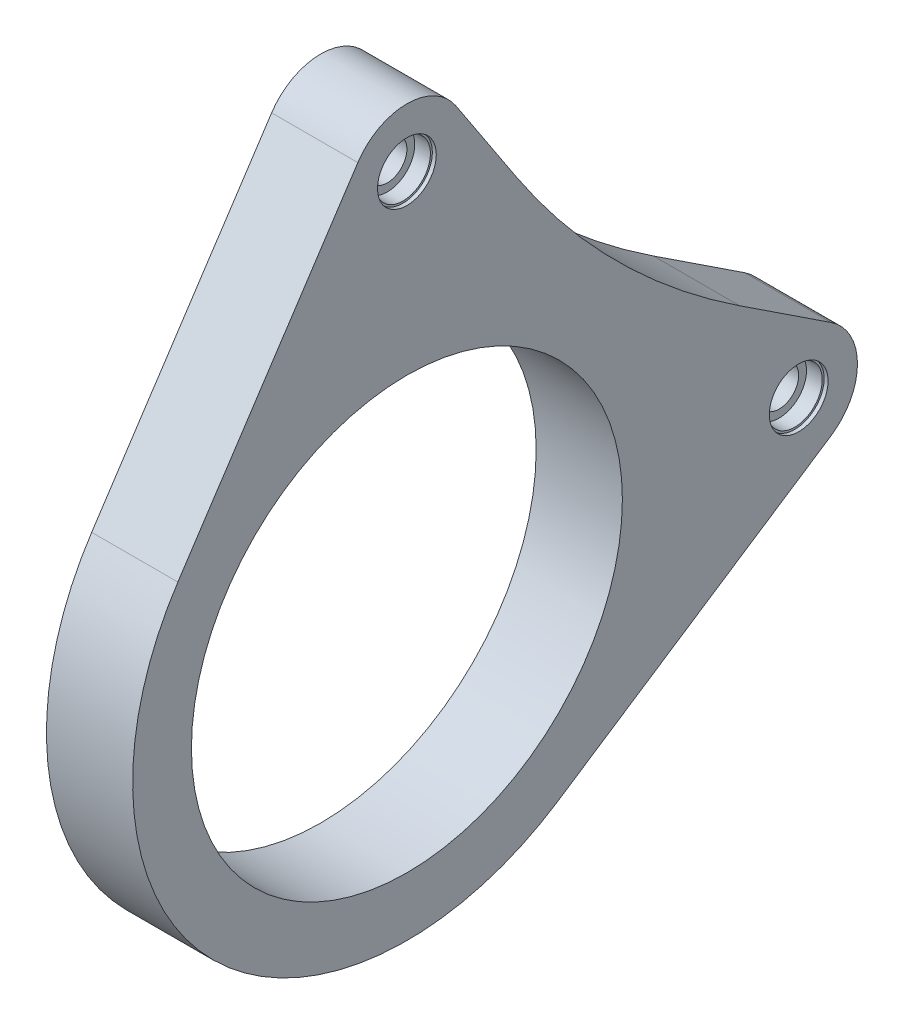
from build123d import *

# Parameters (mm, degrees)
SKETCH1_R                                  = 55
SKETCH1_R_2                                = 5
BOSS_EXTRUDE1_DEPTH                        = 22
SKETCH2_R                                  = 7.5
CUT_EXTRUDE1_DEPTH                         = 1
SKETCH3_R                                  = 7
CUT_EXTRUDE2_DEPTH                         = 4
MIRROR1_AT_THE_SECOND_PLANE_COPY_1_SKETC_R = 7.5
MIRROR1_AT_THE_SECOND_PLANE_COPY_1_DEPTH   = 1
MIRROR1_AT_THE_SECOND_PLANE_COPY_2_SKETC_R = 7
MIRROR1_AT_THE_SECOND_PLANE_COPY_2_DEPTH   = 4
FILLET1_R                                  = 200


with BuildPart() as part:
    # Sketch1 → Boss-Extrude1 (new body)
    with BuildSketch(Plane(origin=(0, 0, 0), x_dir=(0, 0, -1), z_dir=(1, 0, 0))):
        with BuildLine():
            Line((-58.46152581, 38.5), (-12.527469816, 108.25))
            ThreePointArc((-12.527469816, 108.25), (0, 115), (12.527469816, 108.25))
            Line((12.527469816, 108.25), (50.535508379, 50.535508379))
            Line((50.535508379, 50.535508379), (108.25, 12.527469816))
            ThreePointArc((108.25, 12.527469816), (115, 0), (108.25, -12.527469816))
            Line((108.25, -12.527469816), (38.5, -58.46152581))
            ThreePointArc((38.5, -58.46152581), (-49.497474683, -49.497474683), (-58.46152581, 38.5))
        make_face()
        Circle(SKETCH1_R, mode=Mode.SUBTRACT)
        with Locations((0, 100)):
            Circle(SKETCH1_R_2, mode=Mode.SUBTRACT)
        with Locations((100, 0)):
            Circle(SKETCH1_R_2, mode=Mode.SUBTRACT)
    extrude(amount=BOSS_EXTRUDE1_DEPTH)

    # Sketch2 → Cut-Extrude1 (cut)
    with BuildSketch(Plane(origin=(22, 0, 0), x_dir=(0, 0, -1), z_dir=(1, 0, 0))):
        with Locations((0, 100)):
            Circle(SKETCH2_R)
    cut_extrude1 = extrude(amount=-CUT_EXTRUDE1_DEPTH, mode=Mode.SUBTRACT)

    # Sketch3 → Cut-Extrude2 (cut)
    with BuildSketch(Plane(origin=(21, 0, 0), x_dir=(0, 0, -1), z_dir=(1, 0, 0))):
        with Locations((0, 100)):
            Circle(SKETCH3_R)
    cut_extrude2 = extrude(amount=-CUT_EXTRUDE2_DEPTH, mode=Mode.SUBTRACT)

    # Mirror1: Cut-Extrude1, Cut-Extrude2 across plane
    add(cut_extrude1.mirror(Plane(origin=(0, 0, 0), x_dir=(0, -0.7071067811865464, 0.7071067811865487), z_dir=(0, -0.7071067811865487, -0.7071067811865464))), mode=Mode.SUBTRACT)
    add(cut_extrude2.mirror(Plane(origin=(0, 0, 0), x_dir=(0, -0.7071067811865464, 0.7071067811865487), z_dir=(0, -0.7071067811865487, -0.7071067811865464))), mode=Mode.SUBTRACT)

    # Mirror1 at the second plane: Cut-Extrude1, Cut-Extrude2 across plane
    add(cut_extrude1.mirror(Plane(origin=(11, 0, 0), x_dir=(0, 0, 1), z_dir=(1, 0, 0))), mode=Mode.SUBTRACT)
    add(cut_extrude2.mirror(Plane(origin=(11, 0, 0), x_dir=(0, 0, 1), z_dir=(1, 0, 0))), mode=Mode.SUBTRACT)

    # Mirror1 at the second plane copy 1 sketc → Mirror1 at the second plane copy 1 (cut)
    with BuildSketch(Plane(origin=(0, 0, 0), x_dir=(0, 1, 0), z_dir=(-1, 0, 0))):
        with Locations((0, 100)):
            Circle(MIRROR1_AT_THE_SECOND_PLANE_COPY_1_SKETC_R)
    extrude(amount=-MIRROR1_AT_THE_SECOND_PLANE_COPY_1_DEPTH, mode=Mode.SUBTRACT)

    # Mirror1 at the second plane copy 2 sketc → Mirror1 at the second plane copy 2 (cut)
    with BuildSketch(Plane(origin=(1, 0, 0), x_dir=(0, 1, 0), z_dir=(-1, 0, 0))):
        with Locations((0, 100)):
            Circle(MIRROR1_AT_THE_SECOND_PLANE_COPY_2_SKETC_R)
    extrude(amount=-MIRROR1_AT_THE_SECOND_PLANE_COPY_2_DEPTH, mode=Mode.SUBTRACT)

    # Fillet1
    fillet1_edges = [part.edges().sort_by_distance(p)[0] for p in [
        (11, 50.535508379, -50.535508379),
    ]]
    fillet(fillet1_edges, radius=FILLET1_R)


solid = part.part
